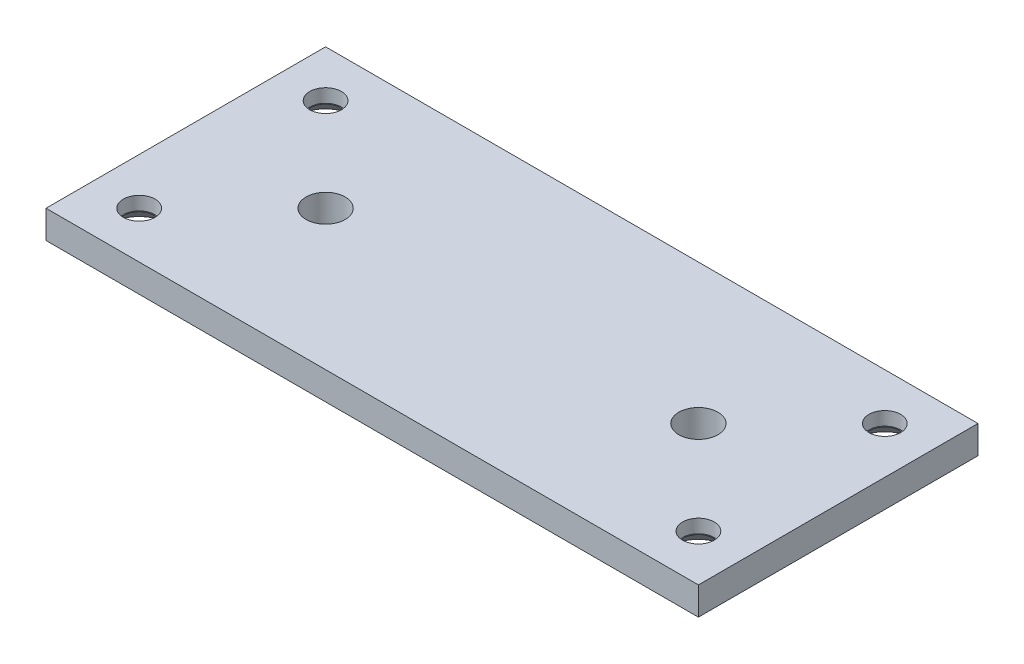
from build123d import *

# Parameters (mm, degrees)
ESQUISSE1_W        = 70
ESQUISSE1_H        = 30
ESQUISSE1_R        = 2.1
BOSS_EXTRU_1_DEPTH = 1.5


# Read off the part's stored shape, not the designer's step: PerçageAvancé1
with BuildPart() as part:
    # Esquisse1 → Boss.-Extru.1 (new, symmetric)
    with BuildSketch(Plane(origin=(0, 0, 0), x_dir=(1, 0, 0), z_dir=(0, 1, 0))):
        Rectangle(ESQUISSE1_W, ESQUISSE1_H)
        with Locations(Location((-20, 0, 0), (0, 0, 270))):
            Circle(ESQUISSE1_R, mode=Mode.SUBTRACT)
        with Locations(Location((20, 0, 0), (0, 0, 90))):
            Circle(ESQUISSE1_R, mode=Mode.SUBTRACT)
    extrude(amount=BOSS_EXTRU_1_DEPTH, both=True)

    # PerçageAvancé1 outline → PerçageAvancé1 (revolve, cut)
    with BuildSketch(Plane(origin=(-30, 0, 10), x_dir=(1, 0, 0), z_dir=(0, 0, 1))):
        Polygon((1.6, 0.05), (1.7, 0.05), (1.7, 1.5), (0, 1.5), (0, -1.5), (3.15, -1.5), align=None)
    revolve(axis=Axis((-30, 0, 10), (0, 1, 0)), mode=Mode.SUBTRACT)

    # Per_ageAvanc_1 2 outline → Per_ageAvanc_1 2 (revolve, cut)
    with BuildSketch(Plane(origin=(30, 0, 10), x_dir=(1, 0, 0), z_dir=(0, 0, 1))):
        Polygon((1.6, 0.05), (1.7, 0.05), (1.7, 1.5), (0, 1.5), (0, -1.5), (3.15, -1.5), align=None)
    revolve(axis=Axis((30, 0, 10), (0, 1, 0)), mode=Mode.SUBTRACT)

    # Per_ageAvanc_1 3 outline → Per_ageAvanc_1 3 (revolve, cut)
    with BuildSketch(Plane(origin=(30, 0, -10), x_dir=(1, 0, 0), z_dir=(0, 0, 1))):
        Polygon((1.6, 0.05), (1.7, 0.05), (1.7, 1.5), (0, 1.5), (0, -1.5), (3.15, -1.5), align=None)
    revolve(axis=Axis((30, 0, -10), (0, 1, 0)), mode=Mode.SUBTRACT)

    # Per_ageAvanc_1 4 outline → Per_ageAvanc_1 4 (revolve, cut)
    with BuildSketch(Plane(origin=(-30, 0, -10), x_dir=(1, 0, 0), z_dir=(0, 0, 1))):
        Polygon((1.6, 0.05), (1.7, 0.05), (1.7, 1.5), (0, 1.5), (0, -1.5), (3.15, -1.5), align=None)
    revolve(axis=Axis((-30, 0, -10), (0, 1, 0)), mode=Mode.SUBTRACT)


solid = part.part
